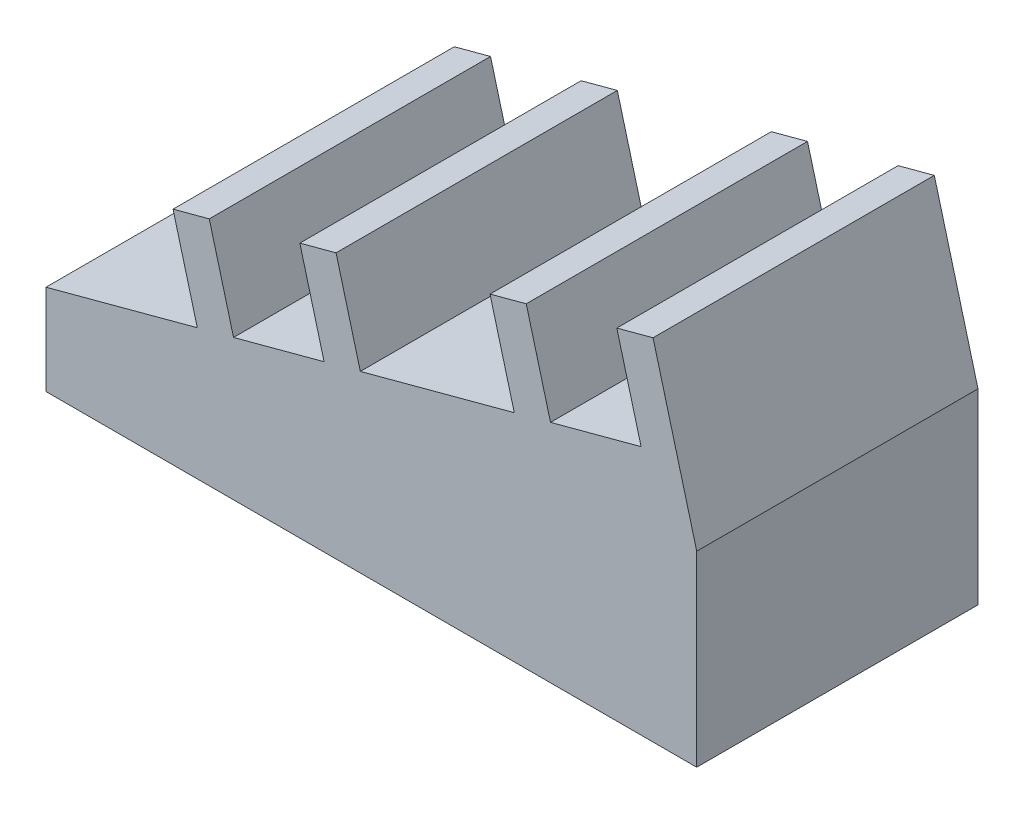
from build123d import *

# Parameters (mm, degrees)
BOSS_EXTRUDE1_DEPTH = 30


with BuildPart() as part:
    # Sketch1 → Boss-Extrude1 (new body)
    with BuildSketch(Plane.XY):
        Polygon((25.091457208, 14.621390072), (15.432198945, 12.033199621), (12.844008494, 21.692457884), (8.980305188, 20.657181704), (11.568495639, 10.997923441), (-4.852243407, 6.597999674), (-7.440433858, 16.257257937), (-11.304137164, 15.221981757), (-8.715946713, 5.562723494), (-18.375204975, 2.974533043), (-20.963395426, 12.633791306), (-24.827098732, 11.598515125), (-22.238908281, 1.939256862), (-38.375204975, -2.384450806), (-38.375204975, -12.025466957), (31.025712874, -12.025466957), (31.025712874, 7.929259643), (26.366970062, 25.315924516), (22.503266757, 24.280648335), align=None)
    extrude(amount=BOSS_EXTRUDE1_DEPTH)


solid = part.part
